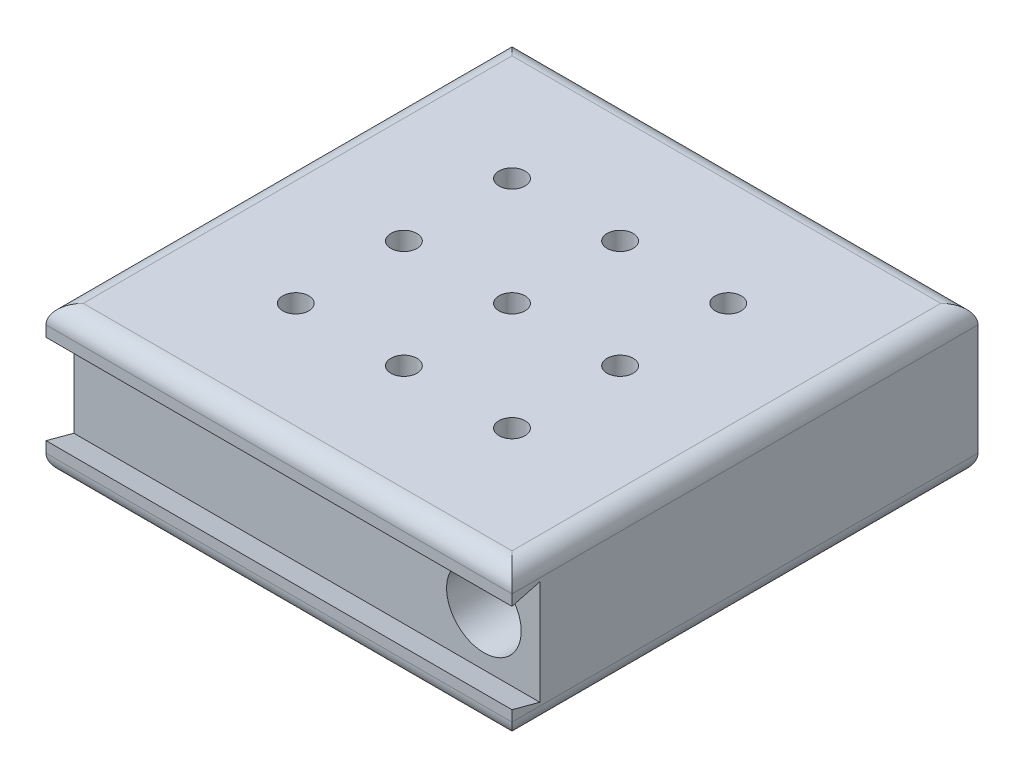
from build123d import *

# Parameters (mm, degrees)
SKETCH1_W           = 125
SKETCH1_H           = 125
BOSS_EXTRUDE1_DEPTH = 39.8
CUT_EXTRUDE1_DEPTH  = 132.8
SKETCH3_R           = 10
CUT_EXTRUDE2_DEPTH  = 40
FILLET1_R           = 5
FILLET2_R           = 5
SKETCH4_R           = 3.5
CUT_EXTRUDE3_DEPTH  = 22


with BuildPart() as part:
    # Sketch1 → Boss-Extrude1 (new body)
    with BuildSketch(Plane(origin=(0, 0, 0), x_dir=(1, 0, 0), z_dir=(0, 1, 0))):
        with Locations((62.5, 62.5)):
            Rectangle(SKETCH1_W, SKETCH1_H)
    extrude(amount=BOSS_EXTRUDE1_DEPTH)

    # Sketch2 → Cut-Extrude1 (cut)
    with BuildSketch(Plane(origin=(125, 0, 0), x_dir=(0, 0, -1), z_dir=(1, 0, 0))):
        Polygon((0, 31.9), (7.464101615, 33.9), (7.464101615, 5.9), (0, 7.9), align=None)
    extrude(amount=-CUT_EXTRUDE1_DEPTH, mode=Mode.SUBTRACT)

    # Sketch3 → Cut-Extrude2 (cut)
    with BuildSketch(Plane.XY.offset(-7.464101615)):
        with Locations((110, 19.9)):
            Circle(SKETCH3_R)
    extrude(amount=-CUT_EXTRUDE2_DEPTH, mode=Mode.SUBTRACT)

    # Fillet1
    fillet1_edges = [part.edges().sort_by_distance(p)[0] for p in [
        (62.5, 39.8, -125),
        (125, 39.8, -62.5),
        (62.5, 39.8, 0),
        (0, 39.8, -62.5),
    ]]
    fillet(fillet1_edges, radius=FILLET1_R)

    # Fillet2
    fillet2_edges = [part.edges().sort_by_distance(p)[0] for p in [
        (62.5, 0, 0),
        (125, 0, -62.5),
        (62.5, 0, -125),
        (0, 0, -62.5),
    ]]
    fillet(fillet2_edges, radius=FILLET2_R)

    # Sketch4 → Cut-Extrude3 (cut)
    with BuildSketch(Plane(origin=(0, 39.8, 0), x_dir=(1, 0, 0), z_dir=(0, 1, 0))):
        with Locations((33.5, 91.5)):
            Circle(SKETCH4_R)
        with Locations((62.5, 91.5)):
            Circle(SKETCH4_R)
        with Locations((91.5, 91.5)):
            Circle(SKETCH4_R)
        with Locations((33.5, 62.5)):
            Circle(SKETCH4_R)
        with Locations((62.5, 62.5)):
            Circle(SKETCH4_R)
        with Locations((91.5, 62.5)):
            Circle(SKETCH4_R)
        with Locations((33.5, 33.5)):
            Circle(SKETCH4_R)
        with Locations((62.5, 33.5)):
            Circle(SKETCH4_R)
        with Locations((91.5, 33.5)):
            Circle(SKETCH4_R)
    extrude(amount=-CUT_EXTRUDE3_DEPTH, mode=Mode.SUBTRACT)


solid = part.part
